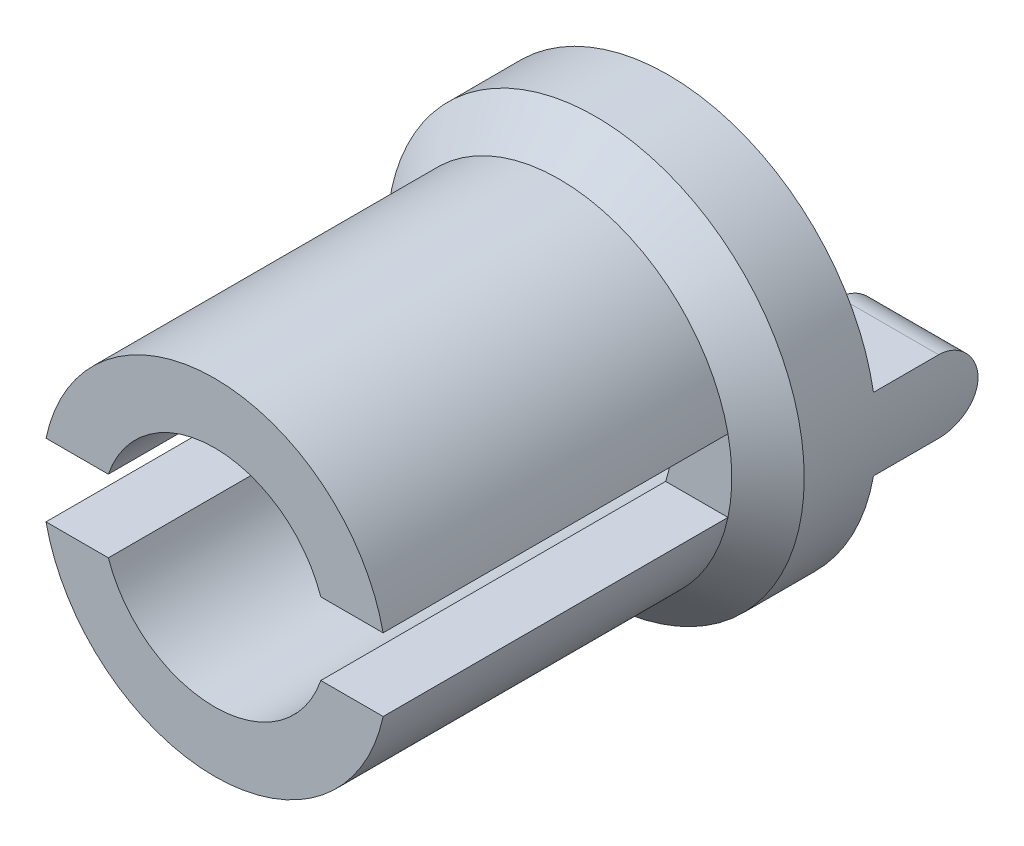
from build123d import *
from build123d.topology import SkipClean

# Parameters (mm, degrees)
SKETCH1_R           = 5.7625
SKETCH1_R_2         = 4.7625
BOSS_EXTRUDE1_DEPTH = 3
BOSS_EXTRUDE2_DEPTH = 12.525
BOSS_EXTRUDE3_START = -2.8
BOSS_EXTRUDE3_DEPTH = 2.8
FILLET1_R           = 1
CHAMFER1_SIZE       = 1


with BuildPart() as part:
    # Sketch1 → Boss-Extrude1 (new body)
    # profile 1 of 9: a face of its own
    with BuildSketch(Plane.XY):
        Circle(SKETCH1_R)
        Circle(SKETCH1_R_2, mode=Mode.SUBTRACT)
    # profile 2 of 9: a face of its own
    with BuildSketch(Plane.XY):
        with BuildLine():
            Line((3.944328363, 1), (3.944328363, -1))
            Line((3.944328363, -1), (4.656329697, -1))
            ThreePointArc((4.656329697, -1), (4.735883045, -0.502810136), (4.7625, 0))
            ThreePointArc((4.7625, 0), (4.735883045, 0.502810136), (4.656329697, 1))
            Line((4.656329697, 1), (3.944328363, 1))
        make_face()
    # profile 3 of 9: a face of its own
    with BuildSketch(Plane.XY):
        with BuildLine():
            Line((2.93428015, -1), (3.944328363, -1))
            Line((3.944328363, -1), (3.944328363, 1))
            Line((3.944328363, 1), (2.93428015, 1))
            ThreePointArc((2.93428015, 1), (3.058289429, 0.506819265), (3.1, 0))
            ThreePointArc((3.1, 0), (3.058289429, -0.506819265), (2.93428015, -1))
        make_face()
    # profile 4 of 9: a face of its own
    with BuildSketch(Plane.XY):
        with BuildLine():
            Line((-4.656329697, -1), (-2.93428015, -1))
            ThreePointArc((-2.93428015, -1), (-3.1, 0), (-2.93428015, 1))
            Line((-2.93428015, 1), (-4.656329697, 1))
            ThreePointArc((-4.656329697, 1), (-4.7625, 0), (-4.656329697, -1))
        make_face()
    # profile 5 of 9: a face of its own
    with BuildSketch(Plane.XY):
        with BuildLine():
            Line((4.656329697, -1), (3.944328363, -1))
            Line((3.944328363, -1), (2.93428015, -1))
            ThreePointArc((2.93428015, -1), (0, -3.1), (-2.93428015, -1))
            Line((-2.93428015, -1), (-4.656329697, -1))
            ThreePointArc((-4.656329697, -1), (0, -4.7625), (4.656329697, -1))
        make_face()
    # profile 6 of 9: a face of its own
    with BuildSketch(Plane.XY):
        with BuildLine():
            Line((2.93428015, 1), (3.944328363, 1))
            Line((3.944328363, 1), (4.656329697, 1))
            ThreePointArc((4.656329697, 1), (0, 4.7625), (-4.656329697, 1))
            Line((-4.656329697, 1), (-2.93428015, 1))
            ThreePointArc((-2.93428015, 1), (0, 3.1), (2.93428015, 1))
        make_face()
    # profile 7 of 9: a face of its own
    with BuildSketch(Plane.XY):
        with BuildLine():
            ThreePointArc((4.7625, 0), (4.735883045, -0.502810136), (4.656329697, -1))
            Line((4.656329697, -1), (5.675068832, -1))
            ThreePointArc((5.675068832, -1), (5.740600596, -0.501907414), (5.7625, 0))
            ThreePointArc((5.7625, 0), (5.740600596, 0.501907414), (5.675068832, 1))
            Line((5.675068832, 1), (4.656329697, 1))
            ThreePointArc((4.656329697, 1), (4.735883045, 0.502810136), (4.7625, 0))
        make_face()
    # profile 8 of 9: a face of its own
    with BuildSketch(Plane.XY):
        with BuildLine():
            Line((5.675068832, -1), (4.656329697, -1))
            ThreePointArc((4.656329697, -1), (0, -4.7625), (-4.656329697, -1))
            Line((-4.656329697, -1), (-5.675068832, -1))
            ThreePointArc((-5.675068832, -1), (0, -5.7625), (5.675068832, -1))
        make_face()
    # profile 9 of 9: a face of its own
    with BuildSketch(Plane.XY):
        with BuildLine():
            Line((-5.675068832, -1), (-4.656329697, -1))
            ThreePointArc((-4.656329697, -1), (-4.7625, 0), (-4.656329697, 1))
            Line((-4.656329697, 1), (-5.675068832, 1))
            ThreePointArc((-5.675068832, 1), (-5.7625, 0), (-5.675068832, -1))
        make_face()
    extrude(amount=BOSS_EXTRUDE1_DEPTH)

    # Sketch1<9> → Boss-Extrude2 (add)
    with BuildSketch(Plane.XY):
        with BuildLine():
            Line((4.656329697, -1), (3.944328363, -1))
            Line((3.944328363, -1), (2.93428015, -1))
            ThreePointArc((2.93428015, -1), (0, -3.1), (-2.93428015, -1))
            Line((-2.93428015, -1), (-4.656329697, -1))
            ThreePointArc((-4.656329697, -1), (0, -4.7625), (4.656329697, -1))
        make_face()
        with BuildLine():
            Line((2.93428015, 1), (3.944328363, 1))
            Line((3.944328363, 1), (4.656329697, 1))
            ThreePointArc((4.656329697, 1), (0, 4.7625), (-4.656329697, 1))
            Line((-4.656329697, 1), (-2.93428015, 1))
            ThreePointArc((-2.93428015, 1), (0, 3.1), (2.93428015, 1))
        make_face()
    extrude(amount=BOSS_EXTRUDE2_DEPTH)

    # Sketch1<10> → Boss-Extrude3 (add)
    with SkipClean():  # the faces are left unmerged after this step: merging them gives an invalid solid
        with BuildSketch(Plane.XY.offset(BOSS_EXTRUDE3_START)):
            with BuildLine():
                Line((2.93428015, -1), (3.944328363, -1))
                Line((3.944328363, -1), (3.944328363, 1))
                Line((3.944328363, 1), (2.93428015, 1))
                ThreePointArc((2.93428015, 1), (3.058289429, 0.506819265), (3.1, 0))
                ThreePointArc((3.1, 0), (3.058289429, -0.506819265), (2.93428015, -1))
            make_face()
            with BuildLine():
                Line((3.944328363, 1), (3.944328363, -1))
                Line((3.944328363, -1), (4.656329697, -1))
                ThreePointArc((4.656329697, -1), (4.735883045, -0.502810136), (4.7625, 0))
                ThreePointArc((4.7625, 0), (4.735883045, 0.502810136), (4.656329697, 1))
                Line((4.656329697, 1), (3.944328363, 1))
            make_face()
            with BuildLine():
                Line((-4.656329697, -1), (-2.93428015, -1))
                ThreePointArc((-2.93428015, -1), (-3.1, 0), (-2.93428015, 1))
                Line((-2.93428015, 1), (-4.656329697, 1))
                ThreePointArc((-4.656329697, 1), (-4.7625, 0), (-4.656329697, -1))
            make_face()
            with BuildLine():
                ThreePointArc((4.7625, 0), (4.735883045, -0.502810136), (4.656329697, -1))
                Line((4.656329697, -1), (5.675068832, -1))
                ThreePointArc((5.675068832, -1), (5.740600596, -0.501907414), (5.7625, 0))
                ThreePointArc((5.7625, 0), (5.740600596, 0.501907414), (5.675068832, 1))
                Line((5.675068832, 1), (4.656329697, 1))
                ThreePointArc((4.656329697, 1), (4.735883045, 0.502810136), (4.7625, 0))
            make_face()
            with BuildLine():
                Line((-5.675068832, -1), (-4.656329697, -1))
                ThreePointArc((-4.656329697, -1), (-4.7625, 0), (-4.656329697, 1))
                Line((-4.656329697, 1), (-5.675068832, 1))
                ThreePointArc((-5.675068832, 1), (-5.7625, 0), (-5.675068832, -1))
            make_face()
        extrude(amount=BOSS_EXTRUDE3_DEPTH)

    # Fillet1
    fillet1_edges = [part.edges().sort_by_distance(p)[0] for p in [
        (-4.304674491, -1, -2.8),
        (-4.304674491, 1, -2.8),
        (4.304674491, 1, -2.8),
        (4.304674491, -1, -2.8),
    ]]
    fillet(fillet1_edges, radius=FILLET1_R - 0.0001)  # a hair under: the kernel refuses the full size

    # Chamfer1
    chamfer1_edges = [part.edges().sort_by_distance(p)[0] for p in [
        (-0.501907414, 5.740600596, 3),
    ]]
    chamfer(chamfer1_edges, length=CHAMFER1_SIZE - 0.0001)  # a hair under: the kernel refuses the full size


solid = part.part
